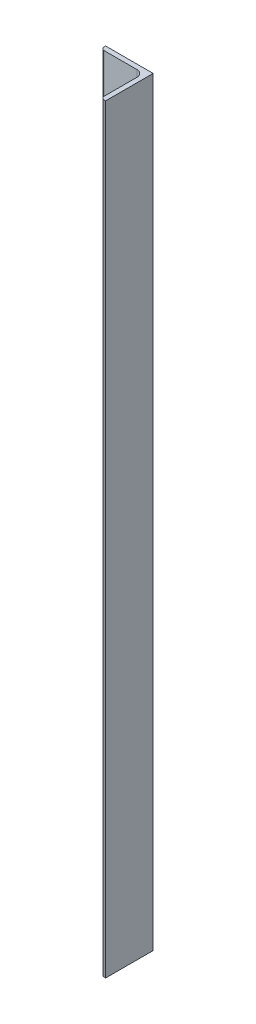
from build123d import *

# Parameters (mm, degrees)
BOSS_EXTRUDE1_DEPTH = 400


with BuildPart() as part:
    # Sketch1 → Boss-Extrude1 (new, symmetric)
    with BuildSketch(Plane(origin=(0, 0, 0), x_dir=(1, 0, 0), z_dir=(0, 1, 0))):
        with BuildLine():
            Line((0, 0), (-50, 0))
            Line((-50, 0), (-50, -1.5))
            ThreePointArc((-50, -1.5), (-48.974873734, -3.974873734), (-46.5, -5))
            Line((-46.5, -5), (-12, -5))
            ThreePointArc((-12, -5), (-7.050252532, -7.050252532), (-5, -12))
            Line((-5, -12), (-5, -46.5))
            ThreePointArc((-5, -46.5), (-3.974873734, -48.974873734), (-1.5, -50))
            Line((-1.5, -50), (0, -50))
            Line((0, -50), (0, 0))
        make_face()
    extrude(amount=BOSS_EXTRUDE1_DEPTH, both=True)


solid = part.part
